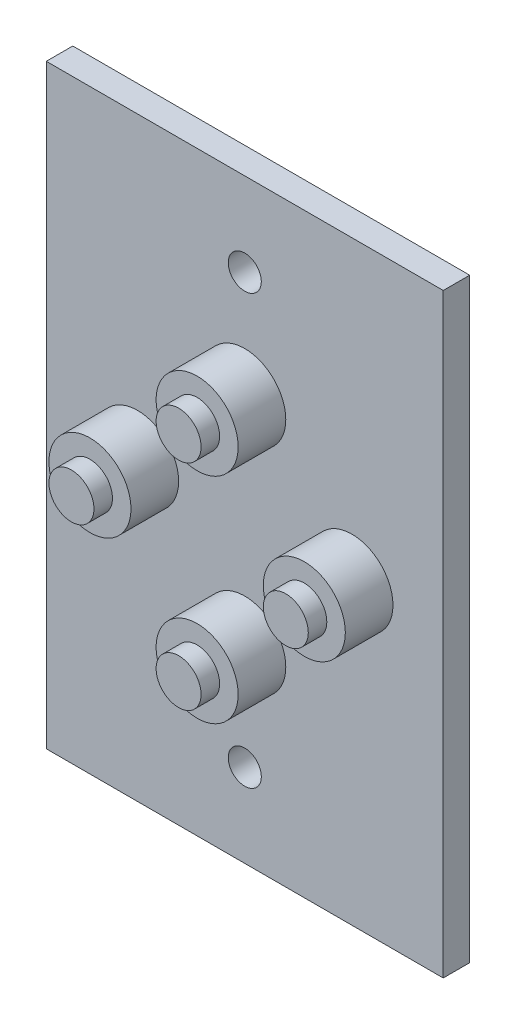
from build123d import *

# Parameters (mm, degrees)
SKETCH1_W           = 30
SKETCH1_H           = 45
BOSS_EXTRUDE1_DEPTH = 2
SKETCH2_R           = 3.1
BOSS_EXTRUDE2_DEPTH = 3.6
SKETCH3_R           = 1.7
BOSS_EXTRUDE3_DEPTH = 1.4
SKETCH4_R           = 1.7
BOSS_EXTRUDE4_DEPTH = 1.4
SKETCH5_R           = 1.7
BOSS_EXTRUDE5_DEPTH = 1.4
SKETCH6_R           = 1.7
BOSS_EXTRUDE6_DEPTH = 1.4
SKETCH7_R           = 1.25
CUT_EXTRUDE1_DEPTH  = 3


with BuildPart() as part:
    # Sketch1 → Boss-Extrude1 (new body)
    with BuildSketch(Plane.XY):
        Rectangle(SKETCH1_W, SKETCH1_H)
    extrude(amount=BOSS_EXTRUDE1_DEPTH)

    # Sketch2 → Boss-Extrude2 (add)
    with BuildSketch(Plane.XY.offset(2)):
        with Locations((-8.1, 0)):
            Circle(SKETCH2_R)
        with Locations((8.1, 0)):
            Circle(SKETCH2_R)
        with Locations((0, 8.1)):
            Circle(SKETCH2_R)
        with Locations((0, -8.1)):
            Circle(SKETCH2_R)
    extrude(amount=BOSS_EXTRUDE2_DEPTH)

    # Sketch3 → Boss-Extrude3 (add)
    with BuildSketch(Plane.XY.offset(5.6)):
        with Locations((0, 8.1)):
            Circle(SKETCH3_R)
    extrude(amount=BOSS_EXTRUDE3_DEPTH)

    # Sketch4 → Boss-Extrude4 (add)
    with BuildSketch(Plane.XY.offset(5.6)):
        with Locations((-8.1, 0)):
            Circle(SKETCH4_R)
    extrude(amount=BOSS_EXTRUDE4_DEPTH)

    # Sketch5 → Boss-Extrude5 (add)
    with BuildSketch(Plane.XY.offset(5.6)):
        with Locations((8.1, 0)):
            Circle(SKETCH5_R)
    extrude(amount=BOSS_EXTRUDE5_DEPTH)

    # Sketch6 → Boss-Extrude6 (add)
    with BuildSketch(Plane.XY.offset(5.6)):
        with Locations((0, -8.1)):
            Circle(SKETCH6_R)
    extrude(amount=BOSS_EXTRUDE6_DEPTH)

    # Sketch7 → Cut-Extrude1 (cut)
    with BuildSketch(Plane.XY.offset(2)):
        with Locations((0, 16.2)):
            Circle(SKETCH7_R)
        with Locations((0, -16.2)):
            Circle(SKETCH7_R)
    extrude(amount=-CUT_EXTRUDE1_DEPTH, mode=Mode.SUBTRACT)


solid = part.part
